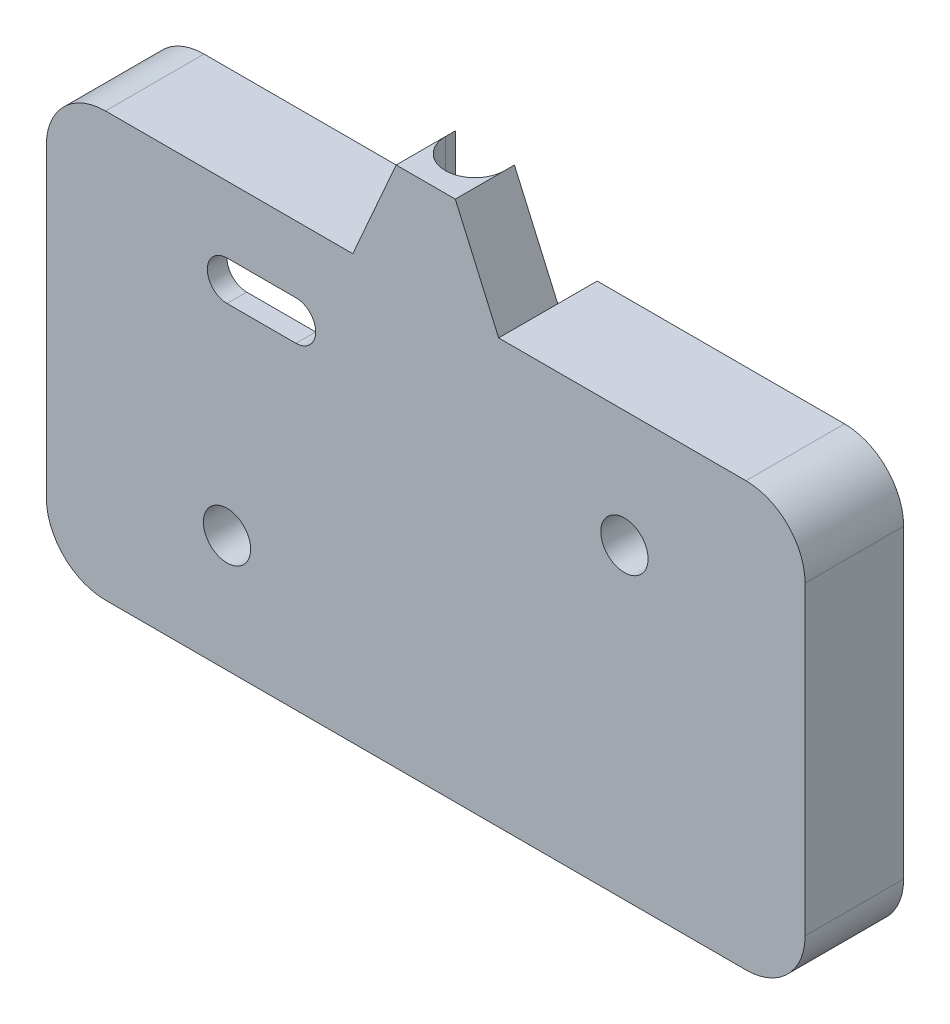
from build123d import *

# Parameters (mm, degrees)
SKICA1_W                 = 38.5
SKICA1_H                 = 21.5
P_IDAT_VYSUNUT_M1_DEPTH  = 1
SKICA2_W                 = 38.5
SKICA2_H                 = 21.5
SKICA2_W_2               = 32.5
SKICA2_H_2               = 15.5
P_IDAT_VYSUNUT_M2_DEPTH  = 4
ZAOBLIT1_R               = 3
SKICA3_R                 = 1.2
ODEBRAT_VYSUNUT_M1_DEPTH = 2
SKICA4_R                 = 1.2
P_IDAT_VYSUNUT_M5_DEPTH  = 2
ODEBRAT_VYSUNUT_M2_DEPTH = 2
P_IDAT_VYSUNUT_M6_DEPTH  = 1
P_IDAT_VYSUNUT_M7_DEPTH  = 2
ODEBRAT_VYSUNUT_M5_DEPTH = 2
SKICA10_W                = 3
SKICA10_H                = 3
ODEBRAT_VYSUNUT_M6_DEPTH = 2
ZKOSEN_2_SIZE            = 2.886751346
ZKOSEN_2_SIZE_2          = 5
ZKOSEN_3_SIZE            = 2.886751346
ZKOSEN_3_SIZE_2          = 5
ZAOBLIT4_R               = 1.5


with BuildPart() as part:
    # Skica1 → Přidat vysunutím1 (new body)
    with BuildSketch(Plane.XY):
        with Locations((19.25, 10.75)):
            Rectangle(SKICA1_W, SKICA1_H)
    extrude(amount=P_IDAT_VYSUNUT_M1_DEPTH)

    # Skica2 → Přidat vysunutím2 (add)
    with BuildSketch(Plane(origin=(0, 0, 0), x_dir=(-1, 0, 0), z_dir=(0, 0, -1))):
        with Locations((-19.25, 10.75)):
            Rectangle(SKICA2_W, SKICA2_H)
        with Locations((-19.25, 10.75)):
            Rectangle(SKICA2_W_2, SKICA2_H_2, mode=Mode.SUBTRACT)
    extrude(amount=P_IDAT_VYSUNUT_M2_DEPTH)

    # Zaoblit1
    zaoblit1_edges = [part.edges().sort_by_distance(p)[0] for p in [
        (0, 0, -1.5),
        (38.5, 0, -1.5),
        (38.5, 21.5, -1.5),
        (0, 21.5, -1.5),
    ]]
    fillet(zaoblit1_edges, radius=ZAOBLIT1_R)

    # Skica3 → Odebrat vysunutím1 (cut)
    with BuildSketch(Plane.XY.offset(1)):
        with Locations((9.166704, 5.920968857)):
            Circle(SKICA3_R)
        with Locations((29.333296, 15.579031143)):
            Circle(SKICA3_R)
    extrude(amount=-ODEBRAT_VYSUNUT_M1_DEPTH, mode=Mode.SUBTRACT)

    # Skica4 → Přidat vysunutím5 (add)
    # profile 1 of 2: a face of its own
    with BuildSketch(Plane(origin=(0, 0, 0), x_dir=(-1, 0, 0), z_dir=(0, 0, -1))):
        with BuildLine():
            ThreePointArc((-30.017358084, 18.5), (-31.197137966, 13.228266772), (-26.333296, 15.579031143))
            ThreePointArc((-26.333296, 15.579031143), (-26.98253163, 17.442873109), (-28.649233916, 18.5))
            Line((-28.649233916, 18.5), (-30.017358084, 18.5))
        make_face()
        with Locations(Location((-29.333296, 15.579031143, 0), (0, 0, 180))):
            Circle(SKICA4_R, mode=Mode.SUBTRACT)
    # profile 2 of 2: a face of its own
    with BuildSketch(Plane(origin=(0, 0, 0), x_dir=(-1, 0, 0), z_dir=(0, 0, -1))):
        with BuildLine():
            ThreePointArc((-8.482641916, 3), (-6.81593963, 4.057126891), (-6.166704, 5.920968857))
            ThreePointArc((-6.166704, 5.920968857), (-11.030545966, 8.271733228), (-9.850766084, 3))
            Line((-9.850766084, 3), (-8.482641916, 3))
        make_face()
        with Locations(Location((-9.166704, 5.920968857, 0), (0, 0, 180))):
            Circle(SKICA4_R, mode=Mode.SUBTRACT)
    extrude(amount=P_IDAT_VYSUNUT_M5_DEPTH)

    # Skica5 → Odebrat vysunutím2 (cut)
    with BuildSketch(Plane.XY.offset(1)):
        with BuildLine():
            Line((9.166704, 18.120968857), (12.666704, 18.120968857))
            ThreePointArc((12.666704, 18.120968857), (13.666704, 17.120968857), (12.666704, 16.120968857))
            Line((12.666704, 16.120968857), (9.166704, 16.120968857))
            ThreePointArc((9.166704, 16.120968857), (8.166704, 17.120968857), (9.166704, 18.120968857))
        make_face()
    extrude(amount=-ODEBRAT_VYSUNUT_M2_DEPTH, mode=Mode.SUBTRACT)

    # Skica7 → Přidat vysunutím6 (add)
    with BuildSketch(Plane.XY.offset(1)):
        Polygon((15.55, 21.5), (17.75, 26.5), (20.75, 26.5), (22.95, 21.5), align=None)
    extrude(amount=-P_IDAT_VYSUNUT_M6_DEPTH)

    # Skica8 → Přidat vysunutím7 (add)
    with BuildSketch(Plane(origin=(0, 0, 0), x_dir=(-1, 0, 0), z_dir=(0, 0, -1))):
        Polygon((-15.55, 21.5), (-17.75, 26.5), (-17.75, 21.5), align=None)
        Polygon((-20.75, 26.5), (-22.95, 21.5), (-20.75, 21.5), align=None)
    extrude(amount=P_IDAT_VYSUNUT_M7_DEPTH)

    # Skica9 → Odebrat vysunutím5 (cut)
    with BuildSketch(Plane(origin=(0, 0, -4), x_dir=(-1, 0, 0), z_dir=(0, 0, -1))):
        Polygon((-22.95, 21.5), (-24.27, 18.5), (-14.23, 18.5), (-15.55, 21.5), align=None)
    extrude(amount=-ODEBRAT_VYSUNUT_M5_DEPTH, mode=Mode.SUBTRACT)

    # Skica10 → Odebrat vysunutím6 (cut)
    with BuildSketch(Plane(origin=(0, 0, -2), x_dir=(-1, 0, 0), z_dir=(0, 0, -1))):
        with Locations((-19.25, 20)):
            Rectangle(SKICA10_W, SKICA10_H)
    extrude(amount=-ODEBRAT_VYSUNUT_M6_DEPTH, mode=Mode.SUBTRACT)

    # Zkosení2
    # the kernel refuses this chamfer: 5, 2.886751346 mm, written as the material it takes off along each edge
    with BuildSketch(Plane(origin=(20.75, 18.5, -14.935428773), x_dir=(0.9983227437537926, -0.057893862402670485, 0), z_dir=(0, 0, 1))) as zkosen_2_piece_1:
        Polygon((ZKOSEN_2_SIZE * 0.998322743736, ZKOSEN_2_SIZE * 0.0578938624016), (-ZKOSEN_2_SIZE_2 * 0.0578938624027, ZKOSEN_2_SIZE_2 * 0.998322743754), (0, 0), align=None)
    extrude(amount=14.935428773, mode=Mode.SUBTRACT)

    # Zkosení3
    # the kernel refuses this chamfer: 5, 2.886751346 mm, written as the material it takes off along each edge
    with BuildSketch(Plane(origin=(17.75, 18.5, -14.935428773), x_dir=(-0.9983227437537926, -0.05789386240267058, 0), z_dir=(0, 0, 1))) as zkosen_3_piece_1:
        Polygon((ZKOSEN_3_SIZE * 0.998322743736, -ZKOSEN_3_SIZE * 0.0578938624016), (-ZKOSEN_3_SIZE_2 * 0.0578938624027, -ZKOSEN_3_SIZE_2 * 0.998322743754), (0, 0), align=None)
    extrude(amount=14.935428773, mode=Mode.SUBTRACT)

    # Zaoblit4
    # the kernel refuses this fillet: 1.5 mm, written as the material it adds along each edge
    with BuildSketch(Plane(origin=(17.75, 26.5, 0), x_dir=(1, 0, 0), z_dir=(0, -1, 0))) as zaoblit4_piece_1_section:
        with BuildLine():
            CenterArc((ZAOBLIT4_R, -ZAOBLIT4_R), ZAOBLIT4_R, 90, 90)
            Line((0, -ZAOBLIT4_R), (0, 0))
            Line((0, 0), (ZAOBLIT4_R, 0))
        make_face()
    zaoblit4_piece_1 = extrude(amount=6.75, mode=Mode.PRIVATE)
    zaoblit4_piece_1 = split(zaoblit4_piece_1, bisect_by=Plane(origin=(17.323921005, 25.531638648, -0.383561124), z_dir=(0.9153150324227655, -0.4027386142660173, 0)), keep=Keep.TOP, mode=Mode.PRIVATE)
    zaoblit4_piece_1 = split(zaoblit4_piece_1, bisect_by=Plane(origin=(18.56429614, 24.910402286, -0.383561124), z_dir=(-0.8660254037846095, 0.4999999999997042, 0)), keep=Keep.TOP, mode=Mode.PRIVATE)
    add(zaoblit4_piece_1)
    with BuildSketch(Plane(origin=(20.75, 19.75, 0), x_dir=(0, 0, -1), z_dir=(0, 1, 0))) as zaoblit4_piece_2_section:
        with BuildLine():
            CenterArc((ZAOBLIT4_R, ZAOBLIT4_R), ZAOBLIT4_R, 180, 90)
            Line((0, ZAOBLIT4_R), (0, 0))
            Line((0, 0), (ZAOBLIT4_R, 0))
        make_face()
    zaoblit4_piece_2 = extrude(amount=6.75, mode=Mode.PRIVATE)
    zaoblit4_piece_2 = split(zaoblit4_piece_2, bisect_by=Plane(origin=(21.176078995, 25.531638648, -0.383561124), z_dir=(-0.9153150324227657, -0.4027386142660168, 0)), keep=Keep.TOP, mode=Mode.PRIVATE)
    zaoblit4_piece_2 = split(zaoblit4_piece_2, bisect_by=Plane(origin=(19.93570386, 24.910402286, -0.383561124), z_dir=(0.8660254037846095, 0.4999999999997042, 0)), keep=Keep.TOP, mode=Mode.PRIVATE)
    add(zaoblit4_piece_2)


solid = part.part
